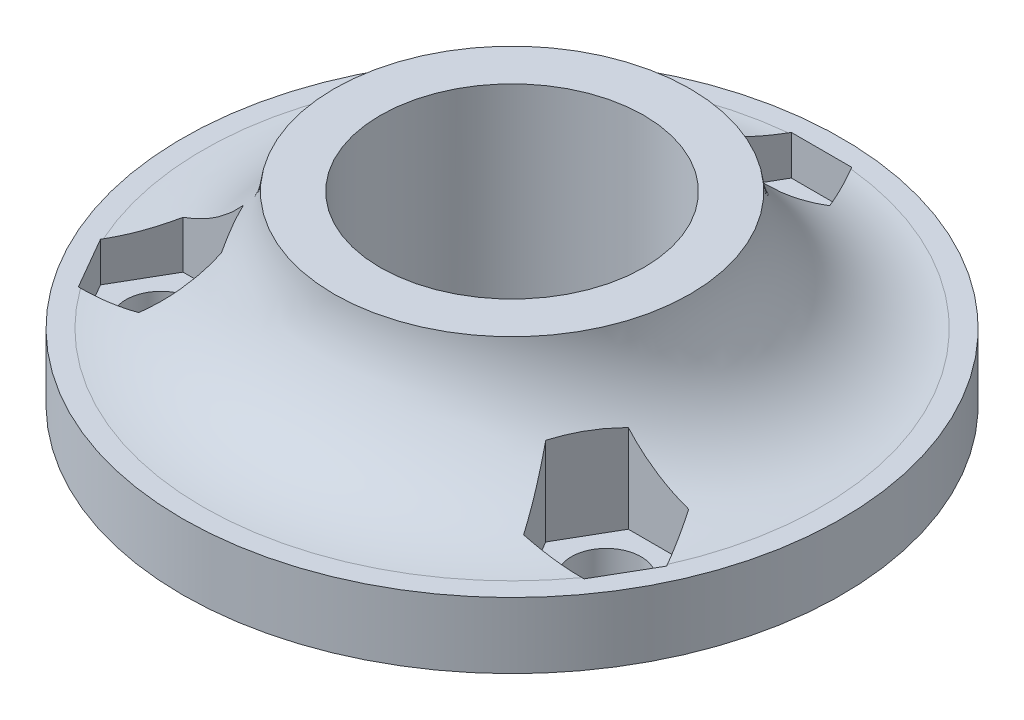
from build123d import *

# Parameters (mm, degrees)
SKETCH1_R           = 25
SKETCH1_R_2         = 10
BOSS_EXTRUDE1_DEPTH = 5
CUT_EXTRUDE1_DEPTH  = 3
SKETCH4_R           = 2.65
CUT_EXTRUDE2_DEPTH  = 36.482389998
CIRPATTERN1_COUNT   = 3
SKETCH6_R           = 13.5
SKETCH6_R_2         = 10
BOSS_EXTRUDE2_DEPTH = 14
FILLET1_START       = 5
FILLET1_2_DEPTH     = 9
BOSS_EXTRUDE3_START = 1.45
SKETCH7_R           = 13.15
SKETCH7_R_2         = 10
BOSS_EXTRUDE3_DEPTH = 1.45


with BuildPart() as part:
    # Sketch1 → Boss-Extrude1 (new body)
    with BuildSketch(Plane(origin=(0, 0, 0), x_dir=(1, 0, 0), z_dir=(0, 1, 0))):
        with Locations(Location((0, 0, 0), (0, 0, 270))):
            Circle(SKETCH1_R)
        with Locations(Location((0, 0, 0), (0, 0, 270))):
            Circle(SKETCH1_R_2, mode=Mode.SUBTRACT)
    extrude(amount=BOSS_EXTRUDE1_DEPTH)

    # Sketch3 → Cut-Extrude1 (cut)
    with BuildSketch(Plane(origin=(0, 5, 0), x_dir=(1, 0, 0), z_dir=(0, 1, 0))):
        Polygon((4.584161137, 19.5), (2.292080569, 23.47), (-2.292080569, 23.47), (-4.584161137, 19.5), (-2.292080569, 15.53), (2.292080569, 15.53), align=None)
    cut_extrude1 = extrude(amount=-CUT_EXTRUDE1_DEPTH, mode=Mode.SUBTRACT)

    # Sketch4 → Cut-Extrude2 (cut, through all)
    with BuildSketch(Plane(origin=(0, 2, 0), x_dir=(1, 0, 0), z_dir=(0, 1, 0))):
        with Locations(Location((0, 19.5, 0), (0, 0, 270))):
            Circle(SKETCH4_R)
    cut_extrude2 = extrude(amount=-CUT_EXTRUDE2_DEPTH, mode=Mode.SUBTRACT)

    # CirPattern1: Cut-Extrude1, Cut-Extrude2 ×3 about axis
    cirpattern1_axis = Axis((0, 0, 0), (0, 1, 0))
    add([cut_extrude1.rotate(cirpattern1_axis, i * 360 / CIRPATTERN1_COUNT) for i in range(1, CIRPATTERN1_COUNT)], mode=Mode.SUBTRACT)
    add([cut_extrude2.rotate(cirpattern1_axis, i * 360 / CIRPATTERN1_COUNT) for i in range(1, CIRPATTERN1_COUNT)], mode=Mode.SUBTRACT)

    # Sketch6 → Boss-Extrude2 (add)
    with BuildSketch(Plane(origin=(0, 0, 0), x_dir=(1, 0, 0), z_dir=(0, 1, 0))):
        with Locations(Location((0, 0, 0), (0, 0, 270))):
            Circle(SKETCH6_R)
        with Locations(Location((0, 0, 0), (0, 0, 270))):
            Circle(SKETCH6_R_2, mode=Mode.SUBTRACT)
    extrude(amount=BOSS_EXTRUDE2_DEPTH)

    # Fillet1: read off the stored shape, not the designer's step
    # Fillet1 outline → Fillet1 (revolve)
    with BuildSketch(Plane.XY):
        with BuildLine():
            ThreePointArc((23.449874371, 5), (16.741670439, 7.583801513), (13.5, 14))
            Line((13.5, 14), (13.5, 5))
            Line((13.5, 5), (23.449874371, 5))
        make_face()
    revolve(axis=Axis((0, 0, 0), (0, 1, 0)))

    # Fillet1 2 outline → Fillet1 2 (cut)
    with BuildSketch(Plane(origin=(0, 0, 0), x_dir=(1, 0, 0), z_dir=(0, 1, 0)).offset(FILLET1_START)):
        Polygon((-2.292080569, 15.53), (2.292080569, 15.53), (4.584161137, 19.5), (2.292080569, 23.47), (1.408734657, 25), (-1.408734657, 25), (-2.292080569, 23.47), (-4.584161137, 19.5), align=None)
        Polygon((23, -13.72), (23, -12.397168574), (19.179575942, -5.78), (14.595414805, -5.78), (12.303334236, -9.75), (14.595414805, -13.72), align=None)
        Polygon((-19.179575942, -5.78), (-23, -12.397168574), (-23, -13.72), (-14.595414805, -13.72), (-12.303334236, -9.75), (-14.595414805, -5.78), align=None)
    extrude(amount=FILLET1_2_DEPTH, mode=Mode.SUBTRACT)

    # Sketch7 → Boss-Extrude3 (add)
    with BuildSketch(Plane.XZ.offset(BOSS_EXTRUDE3_START)):
        with Locations(Location((0, 0, 0), (0, 0, 90))):
            Circle(SKETCH7_R)
        with Locations(Location((0, 0, 0), (0, 0, 270))):
            Circle(SKETCH7_R_2, mode=Mode.SUBTRACT)
    extrude(amount=-BOSS_EXTRUDE3_DEPTH)


solid = part.part
